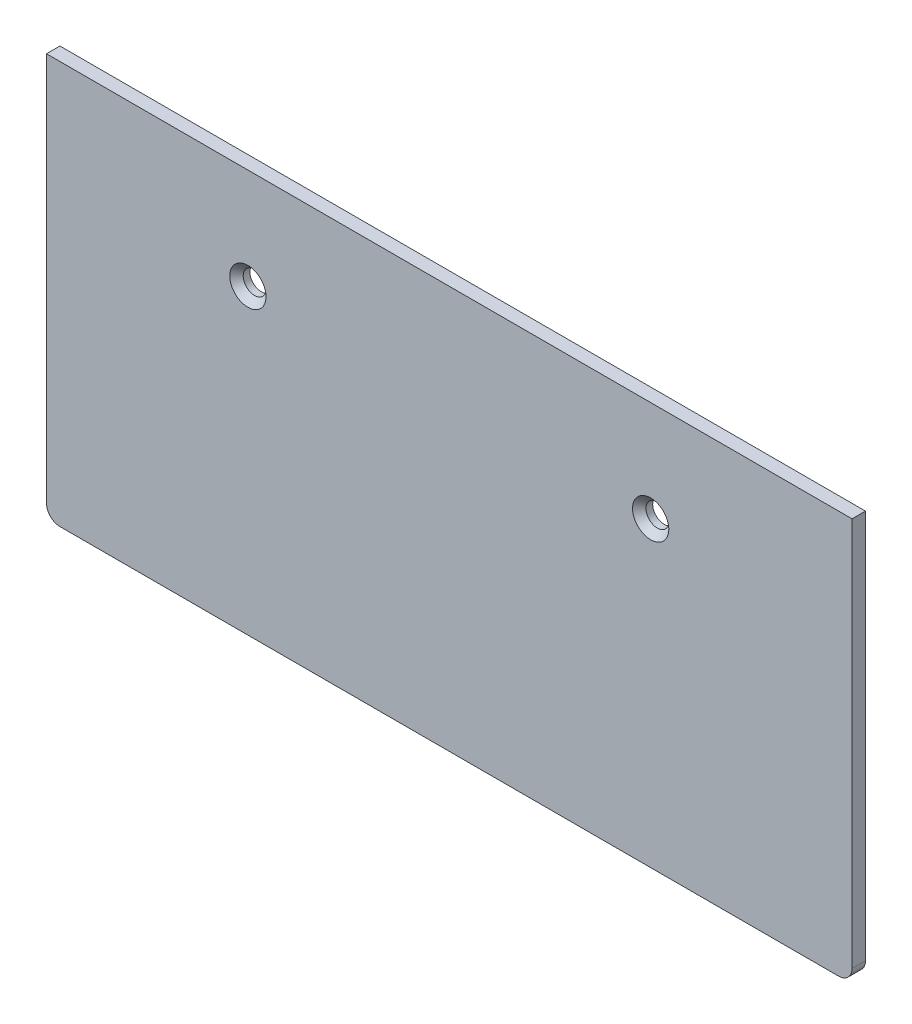
from build123d import *

# Parameters (mm, degrees)
SCHIZZO1_W                   = 120
SCHIZZO1_H                   = 60
SCHIZZO1_R                   = 1.7
ESTRUSIONE_ESTRUSIONE2_DEPTH = 2
RACCORDO1_R                  = 2
RACCORDO2_R                  = 2
SMUSSO1_SIZE                 = 1
SMUSSO2_SIZE                 = 1


with BuildPart() as part:
    # Schizzo1 → Estrusione-Estrusione2 (new body)
    with BuildSketch(Plane.XY):
        with Locations((60, 30)):
            Rectangle(SCHIZZO1_W, SCHIZZO1_H)
        with Locations((90, 45)):
            Circle(SCHIZZO1_R, mode=Mode.SUBTRACT)
        with Locations((30, 45)):
            Circle(SCHIZZO1_R, mode=Mode.SUBTRACT)
    extrude(amount=-ESTRUSIONE_ESTRUSIONE2_DEPTH)

    # Raccordo1
    raccordo1_edges = [part.edges().sort_by_distance(p)[0] for p in [
        (0, 0, -1),
    ]]
    fillet(raccordo1_edges, radius=RACCORDO1_R)

    # Raccordo2
    raccordo2_edges = [part.edges().sort_by_distance(p)[0] for p in [
        (120, 0, -1),
    ]]
    fillet(raccordo2_edges, radius=RACCORDO2_R)

    # Smusso1
    smusso1_edges = [part.edges().sort_by_distance(p)[0] for p in [
        (28.3, 45, 0),
    ]]
    chamfer(smusso1_edges, length=SMUSSO1_SIZE)

    # Smusso2
    smusso2_edges = [part.edges().sort_by_distance(p)[0] for p in [
        (88.3, 45, 0),
    ]]
    chamfer(smusso2_edges, length=SMUSSO2_SIZE)


solid = part.part
